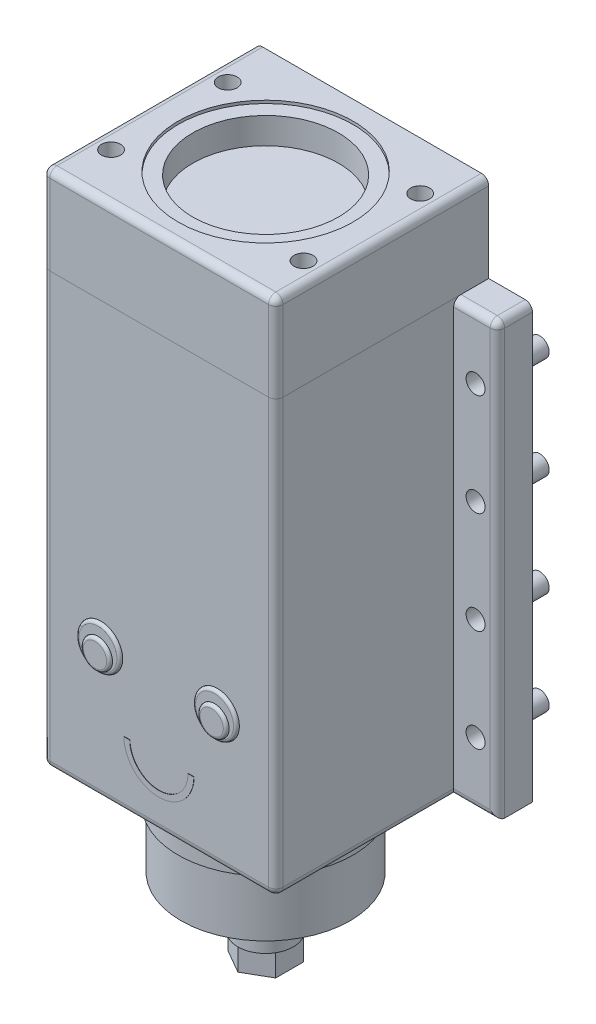
from build123d import *

# Parameters (mm, degrees)
SKETCH1_W             = 110
SKETCH1_H             = 148
SKETCH1_R             = 3.25
BOSS_EXTRUDE1_DEPTH   = 12
SKETCH3_R             = 3.25
BOSS_EXTRUDE2_DEPTH   = 10
BOSS_EXTRUDE2_2_DEPTH = 10
BOSS_EXTRUDE2_3_DEPTH = 10
BOSS_EXTRUDE2_4_DEPTH = 10
BOSS_EXTRUDE2_5_DEPTH = 10
BOSS_EXTRUDE2_6_DEPTH = 10
BOSS_EXTRUDE2_7_DEPTH = 10
BOSS_EXTRUDE2_8_DEPTH = 10
SKETCH4_W             = 80
SKETCH4_H             = 148
BOSS_EXTRUDE3_DEPTH   = 61
SKETCH5_W             = 80
SKETCH5_H             = 73
BOSS_EXTRUDE4_DEPTH   = 30
SKETCH6_R             = 30
SKETCH6_R_2           = 25
CUT_EXTRUDE1_DEPTH    = 1
SKETCH8_R             = 25
CUT_EXTRUDE2_DEPTH    = 10
SKETCH10_R            = 3.25
CUT_EXTRUDE3_DEPTH    = 10
SKETCH11_R            = 30
BOSS_EXTRUDE5_DEPTH   = 10
SKETCH13_R            = 29
BOSS_EXTRUDE6_DEPTH   = 20
SKETCH14_R            = 7.5
BOSS_EXTRUDE7_DEPTH   = 10
SKETCH15_R            = 9.5
BOSS_EXTRUDE8_DEPTH   = 7.5
BOSS_EXTRUDE9_DEPTH   = 7.5
SKETCH17_R            = 5.75
CUT_EXTRUDE4_DEPTH    = 18
SKETCH18_R            = 3.25
CUT_EXTRUDE6_DEPTH    = 5
FILLET1_R             = 2.5
FILLET2_R             = 2.5
SKETCH19_R            = 7.5
BOSS_EXTRUDE10_DEPTH  = 1
SKETCH20_R            = 5
BOSS_EXTRUDE11_DEPTH  = 1
FILLET4_R             = 1
FILLET5_R             = 1
BOSS_EXTRUDE12_DEPTH  = 0.1


with BuildPart() as part:
    # Sketch1 → Boss-Extrude1 (new body)
    with BuildSketch(Plane.XY):
        Rectangle(SKETCH1_W, SKETCH1_H)
        with Locations((47.5, -52.5)):
            Circle(SKETCH1_R, mode=Mode.SUBTRACT)
        with Locations((47.5, -17.5)):
            Circle(SKETCH1_R, mode=Mode.SUBTRACT)
        with Locations((47.5, 17.5)):
            Circle(SKETCH1_R, mode=Mode.SUBTRACT)
        with Locations((47.5, 52.5)):
            Circle(SKETCH1_R, mode=Mode.SUBTRACT)
        with Locations(Location((-47.5, -52.5, 0), (0, 0, 180))):
            Circle(SKETCH1_R, mode=Mode.SUBTRACT)
        with Locations(Location((-47.5, -17.5, 0), (0, 0, 180))):
            Circle(SKETCH1_R, mode=Mode.SUBTRACT)
        with Locations(Location((-47.5, 17.5, 0), (0, 0, 180))):
            Circle(SKETCH1_R, mode=Mode.SUBTRACT)
        with Locations(Location((-47.5, 52.5, 0), (0, 0, 180))):
            Circle(SKETCH1_R, mode=Mode.SUBTRACT)
    extrude(amount=BOSS_EXTRUDE1_DEPTH)

    # Sketch4 → Boss-Extrude3 (add)
    with BuildSketch(Plane.XY.offset(12)):
        Rectangle(SKETCH4_W, SKETCH4_H)
    extrude(amount=BOSS_EXTRUDE3_DEPTH)

    # Sketch11 → Boss-Extrude5 (add)
    with BuildSketch(Plane.XZ.offset(74)):
        with Locations(Location((0, 36.5, 0), (0, 0, 90))):
            Circle(SKETCH11_R)
    extrude(amount=BOSS_EXTRUDE5_DEPTH)

    # Sketch13 → Boss-Extrude6 (add)
    with BuildSketch(Plane.XZ.offset(84)):
        with Locations(Location((0, 36.5, 0), (0, 0, 270))):
            Circle(SKETCH13_R)
    extrude(amount=BOSS_EXTRUDE6_DEPTH)

    # Sketch14 → Boss-Extrude7 (add)
    with BuildSketch(Plane.XZ.offset(104)):
        with Locations(Location((0, 36.5, 0), (0, 0, 270))):
            Circle(SKETCH14_R)
    extrude(amount=BOSS_EXTRUDE7_DEPTH)

    # Sketch15 → Boss-Extrude8 (add)
    with BuildSketch(Plane.XZ.offset(114)):
        with Locations(Location((0, 36.5, 0), (0, 0, 270))):
            Circle(SKETCH15_R)
    extrude(amount=BOSS_EXTRUDE8_DEPTH)

    # Sketch16 → Boss-Extrude9 (add)
    with BuildSketch(Plane.XZ.offset(121.5)):
        Polygon((-8.227241336, 41.25), (-8.227241336, 31.75), (0, 27), (8.227241336, 31.75), (8.227241336, 41.25), (0, 46), align=None)
    extrude(amount=BOSS_EXTRUDE9_DEPTH)

    # Sketch17 → Cut-Extrude4 (cut)
    with BuildSketch(Plane.XZ.offset(129)):
        with Locations(Location((0, 36.5, 0), (0, 0, 270))):
            Circle(SKETCH17_R)
    extrude(amount=-CUT_EXTRUDE4_DEPTH, mode=Mode.SUBTRACT)

    # Sketch18 → Cut-Extrude6 (cut)
    with BuildSketch(Plane.XZ.offset(104)):
        with Locations(Location((15, 51.5, 0), (0, 0, 270))):
            Circle(SKETCH18_R)
        with Locations(Location((15, 21.5, 0), (0, 0, 90))):
            Circle(SKETCH18_R)
        with Locations(Location((-15, 21.5, 0), (0, 0, 270))):
            Circle(SKETCH18_R)
        with Locations(Location((-15, 51.5, 0), (0, 0, 90))):
            Circle(SKETCH18_R)
    extrude(amount=-CUT_EXTRUDE6_DEPTH, mode=Mode.SUBTRACT)

    # Fillet1
    fillet1_edges = [part.edges().sort_by_distance(p)[0] for p in [
        (-55, 0, 12),
        (-47.5, -74, 12),
        (-47.5, 74, 12),
        (55, 0, 12),
        (47.5, -74, 12),
        (40, -74, 42.5),
        (-40, -74, 42.5),
        (40, 0, 73),
        (-40, 0, 73),
        (0, -74, 73),
        (-55, 74, 6),
        (55, 74, 6),
        (47.5, 74, 12),
    ]]
    fillet(fillet1_edges, radius=FILLET1_R)

    # Sketch19 → Boss-Extrude10 (add)
    with BuildSketch(Plane.XY.offset(73)):
        with Locations(Location((-20, -28.75, 0), (0, 0, 180))):
            Circle(SKETCH19_R)
        with Locations(Location((20, -28.75, 0), (0, 0, 180))):
            Circle(SKETCH19_R)
    extrude(amount=BOSS_EXTRUDE10_DEPTH)

    # Sketch20 → Boss-Extrude11 (add)
    with BuildSketch(Plane.XY.offset(74)):
        with Locations((-20, -30.25)):
            Circle(SKETCH20_R)
        with Locations(Location((20, -30.25, 0), (0, 0, 180))):
            Circle(SKETCH20_R)
    extrude(amount=BOSS_EXTRUDE11_DEPTH)

    # Fillet4
    fillet4_edges = [part.edges().sort_by_distance(p)[0] for p in [
        (-12.5, -28.75, 74),
        (27.5, -28.75, 74),
    ]]
    fillet(fillet4_edges, radius=FILLET4_R - 0.0001)  # a hair under: the kernel refuses the full size

    # Fillet5
    fillet5_edges = [part.edges().sort_by_distance(p)[0] for p in [
        (-25, -30.25, 75),
        (25, -30.25, 75),
    ]]
    fillet(fillet5_edges, radius=FILLET5_R - 0.0001)  # a hair under: the kernel refuses the full size

    # Sketch21 → Boss-Extrude12 (add)
    with BuildSketch(Plane.XY.offset(73)):
        with BuildLine():
            Line((-12, -51.5), (-10, -51.5))
            ThreePointArc((-10, -51.5), (0, -61.5), (10, -51.5))
            Line((10, -51.5), (12, -51.5))
            ThreePointArc((12, -51.5), (0, -63.5), (-12, -51.5))
        make_face()
    extrude(amount=BOSS_EXTRUDE12_DEPTH)


with BuildPart() as body_2:
    # Sketch3 → Boss-Extrude2 (new body)
    with BuildSketch(Plane(origin=(0, 0, 0), x_dir=(-1, 0, 0), z_dir=(0, 0, -1))):
        with Locations((-47.5, 52.5)):
            Circle(SKETCH3_R)
    extrude(amount=BOSS_EXTRUDE2_DEPTH)


with BuildPart() as body_3:
    # Sketch3 → Boss-Extrude2 2 (new body)
    with BuildSketch(Plane(origin=(0, 0, 0), x_dir=(-1, 0, 0), z_dir=(0, 0, -1))):
        with Locations((-47.5, 17.5)):
            Circle(SKETCH3_R)
    extrude(amount=BOSS_EXTRUDE2_2_DEPTH)


with BuildPart() as body_4:
    # Sketch3 → Boss-Extrude2 3 (new body)
    with BuildSketch(Plane(origin=(0, 0, 0), x_dir=(-1, 0, 0), z_dir=(0, 0, -1))):
        with Locations((-47.5, -17.5)):
            Circle(SKETCH3_R)
    extrude(amount=BOSS_EXTRUDE2_3_DEPTH)


with BuildPart() as body_5:
    # Sketch3 → Boss-Extrude2 4 (new body)
    with BuildSketch(Plane(origin=(0, 0, 0), x_dir=(-1, 0, 0), z_dir=(0, 0, -1))):
        with Locations((-47.5, -52.5)):
            Circle(SKETCH3_R)
    extrude(amount=BOSS_EXTRUDE2_4_DEPTH)


with BuildPart() as body_6:
    # Sketch3 → Boss-Extrude2 5 (new body)
    with BuildSketch(Plane(origin=(0, 0, 0), x_dir=(-1, 0, 0), z_dir=(0, 0, -1))):
        with Locations((47.5, -52.5)):
            Circle(SKETCH3_R)
    extrude(amount=BOSS_EXTRUDE2_5_DEPTH)


with BuildPart() as body_7:
    # Sketch3 → Boss-Extrude2 6 (new body)
    with BuildSketch(Plane(origin=(0, 0, 0), x_dir=(-1, 0, 0), z_dir=(0, 0, -1))):
        with Locations((47.5, -17.5)):
            Circle(SKETCH3_R)
    extrude(amount=BOSS_EXTRUDE2_6_DEPTH)


with BuildPart() as body_8:
    # Sketch3 → Boss-Extrude2 7 (new body)
    with BuildSketch(Plane(origin=(0, 0, 0), x_dir=(-1, 0, 0), z_dir=(0, 0, -1))):
        with Locations((47.5, 17.5)):
            Circle(SKETCH3_R)
    extrude(amount=BOSS_EXTRUDE2_7_DEPTH)


with BuildPart() as body_9:
    # Sketch3 → Boss-Extrude2 8 (new body)
    with BuildSketch(Plane(origin=(0, 0, 0), x_dir=(-1, 0, 0), z_dir=(0, 0, -1))):
        with Locations((47.5, 52.5)):
            Circle(SKETCH3_R)
    extrude(amount=BOSS_EXTRUDE2_8_DEPTH)


with BuildPart() as body_10:
    # Sketch5 → Boss-Extrude4 (new body)
    with BuildSketch(Plane(origin=(0, 74, 0), x_dir=(1, 0, 0), z_dir=(0, 1, 0))):
        with Locations((0, -36.5)):
            Rectangle(SKETCH5_W, SKETCH5_H)
    extrude(amount=BOSS_EXTRUDE4_DEPTH)

    # Sketch6 → Cut-Extrude1 (cut)
    with BuildSketch(Plane(origin=(0, 104, 0), x_dir=(1, 0, 0), z_dir=(0, 1, 0))):
        with Locations(Location((0, -36.5, 0), (0, 0, 270))):
            Circle(SKETCH6_R)
        with Locations(Location((0, -36.5, 0), (0, 0, 270))):
            Circle(SKETCH6_R_2, mode=Mode.SUBTRACT)
    extrude(amount=-CUT_EXTRUDE1_DEPTH, mode=Mode.SUBTRACT)

    # Sketch8 → Cut-Extrude2 (cut)
    with BuildSketch(Plane(origin=(0, 104, 0), x_dir=(1, 0, 0), z_dir=(0, 1, 0))):
        with Locations(Location((0, -36.5, 0), (0, 0, 270))):
            Circle(SKETCH8_R)
    extrude(amount=-CUT_EXTRUDE2_DEPTH, mode=Mode.SUBTRACT)

    # Sketch10 → Cut-Extrude3 (cut)
    with BuildSketch(Plane(origin=(0, 104, 0), x_dir=(1, 0, 0), z_dir=(0, 1, 0))):
        with Locations(Location((33, -16.5, 0), (0, 0, 270))):
            Circle(SKETCH10_R)
        with Locations(Location((33, -56.5, 0), (0, 0, 90))):
            Circle(SKETCH10_R)
        with Locations(Location((-33, -56.5, 0), (0, 0, 270))):
            Circle(SKETCH10_R)
        with Locations(Location((-33, -16.5, 0), (0, 0, 90))):
            Circle(SKETCH10_R)
    extrude(amount=-CUT_EXTRUDE3_DEPTH, mode=Mode.SUBTRACT)

    # Fillet2
    fillet2_edges = [body_10.edges().sort_by_distance(p)[0] for p in [
        (40, 104, 36.5),
        (-40, 104, 36.5),
        (40, 89, 73),
        (-40, 89, 73),
        (0, 104, 73),
    ]]
    fillet(fillet2_edges, radius=FILLET2_R)


solid = Compound([part.part, body_2.part, body_3.part, body_4.part, body_5.part, body_6.part, body_7.part, body_8.part, body_9.part, body_10.part])
